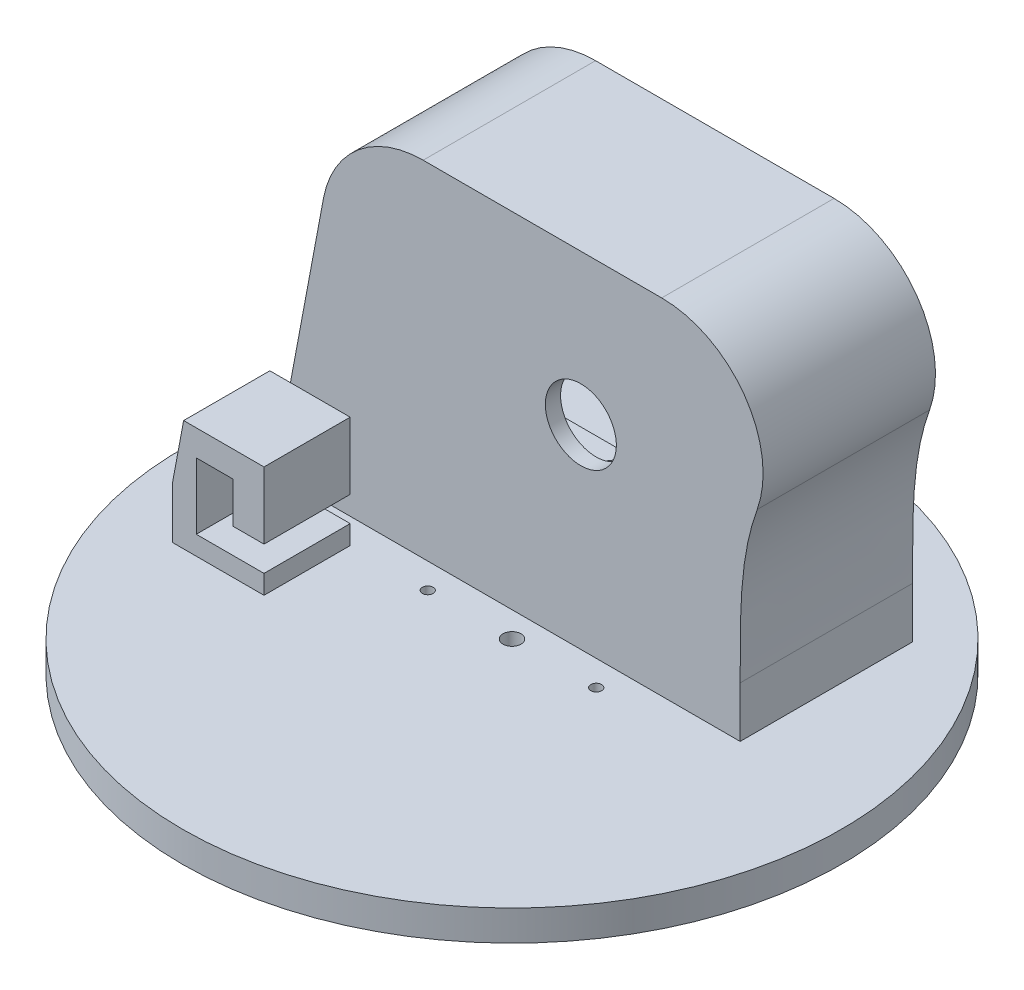
from build123d import *

# Parameters (mm, degrees)
SKETCH1_R           = 32.5
SKETCH1_R_2         = 0.889
SKETCH1_R_3         = 0.5335
BOSS_EXTRUDE1_DEPTH = 3
SKETCH2_W           = 45
SKETCH2_H           = 17
BOSS_EXTRUDE2_DEPTH = 5
LOFT1_START         = -19.5
LOFT1_DEPTH         = 17
FILLET2_R           = 10
CUT_EXTRUDE7_DEPTH  = 6.5
CUT_EXTRUDE8_DEPTH  = 9
SKETCH59_R          = 1.05
CUT_EXTRUDE9_DEPTH  = 6
SKETCH60_R          = 3.5
CUT_EXTRUDE10_DEPTH = 62.304245363
BOSS_EXTRUDE3_DEPTH = 11
CUT_EXTRUDE11_REACH = 53.415
SKETCH62_W          = 9.042987319
SKETCH62_H          = 2.5
SKETCH63_W          = 22
SKETCH63_H          = 5.75
CUT_EXTRUDE12_DEPTH = 10


# Read off the part's stored shape, not the designer's step: Loft1
with BuildPart() as part:
    # Sketch1 → Boss-Extrude1 (new body)
    with BuildSketch(Plane(origin=(0, 0, 0), x_dir=(1, 0, 0), z_dir=(0, 1, 0))):
        with Locations(Location((0, 0, 0), (0, 0, 270))):
            Circle(SKETCH1_R)
        with Locations(Location((0, 0, 0), (0, 0, 270))):
            Circle(SKETCH1_R_2, mode=Mode.SUBTRACT)
        with Locations(Location((-8.306, 0, 0), (0, 0, 270))):
            Circle(SKETCH1_R_3, mode=Mode.SUBTRACT)
        with Locations(Location((8.306, 0, 0), (0, 0, 90))):
            Circle(SKETCH1_R_3, mode=Mode.SUBTRACT)
    extrude(amount=BOSS_EXTRUDE1_DEPTH)

    # Sketch2 → Boss-Extrude2 (add)
    with BuildSketch(Plane(origin=(0, 3, 0), x_dir=(1, 0, 0), z_dir=(0, 1, 0))):
        with Locations((-2.5, 11)):
            Rectangle(SKETCH2_W, SKETCH2_H)
    extrude(amount=BOSS_EXTRUDE2_DEPTH)

    # Loft1 outline → Loft1 (add)
    with BuildSketch(Plane.XY.offset(LOFT1_START)):
        with BuildLine():
            Line((-25, 8), (20, 8))
            add(Edge.make_bspline(
                [(20, 8), (20.013119001, 12.366637273), (19.711715011, 23.342908392), (26.277458631, 32.792620463), (30.786821215, 37.0096)],
                knots=[0, 0, 0, 0, 0.412101617, 1, 1, 1, 1], degree=3))
            Line((30.786821215, 37.0096), (-19.558686419, 37.0096))
            Line((-19.558686419, 37.0096), (-25, 8))
        make_face()
    extrude(amount=LOFT1_DEPTH)

    # Fillet2
    fillet2_edges = [part.edges().sort_by_distance(p)[0] for p in [
        (30.786821215, 37.0096, -11),
        (-19.558686419, 37.0096, -11),
    ]]
    fillet(fillet2_edges, radius=FILLET2_R)

    # Sketch56 → Cut-Extrude7 (cut)
    with BuildSketch(Plane(origin=(0, 0, -19.5), x_dir=(-1, 0, 0), z_dir=(0, 0, -1))):
        with BuildLine():
            Line((11.259989716, 35.0096), (-12.262162003, 35.0096))
            ThreePointArc((-12.262162003, 35.0096), (-18.800326154, 31.619633572), (-19.797451062, 24.322702384))
            add(Edge.make_bspline(
                [(-19.797451062, 24.322702384), (-19.33456189, 23.024549565), (-18.970633179, 21.699807372), (-18.444923303, 18.9960086), (-18.278988003, 17.628977113), (-18.070720499, 14.883614823), (-18.028473243, 13.506968306), (-17.995025378, 10.755326884), (-18.004134147, 9.379048249), (-18, 8.003004365)],
                knots=[0, 0, 0, 0, 0.25, 0.25, 0.5, 0.5, 0.75, 0.75, 1, 1, 1, 1], degree=3))
            Line((-18, 8.003004365), (-18, 5))
            Line((-18, 5), (23, 5))
            Line((23, 5), (23, 7.814051971))
            Line((23, 7.814051971), (19.122868337, 28.484435511))
            ThreePointArc((19.122868337, 28.484435511), (16.368870019, 33.165844151), (11.259989716, 35.0096))
        make_face()
    extrude(amount=-CUT_EXTRUDE7_DEPTH, mode=Mode.SUBTRACT)

    # Sketch57 → Cut-Extrude8 (cut)
    with BuildSketch(Plane(origin=(0, 0, -13), x_dir=(-1, 0, 0), z_dir=(0, 0, -1))):
        Polygon((-6.147589592, 30.253616288), (-12.539757722, 19.62816634), (6.997359924, 7.874824939), (13.389528054, 18.500274887), align=None)
    extrude(amount=-CUT_EXTRUDE8_DEPTH, mode=Mode.SUBTRACT)

    # Sketch59 → Cut-Extrude9 (cut)
    with BuildSketch(Plane(origin=(0, 0, -13), x_dir=(-1, 0, 0), z_dir=(0, 0, -1))):
        with Locations((-11.850080197, 26.448721296)):
            Circle(SKETCH59_R)
        with Locations((12.699850529, 11.679719931)):
            Circle(SKETCH59_R)
    extrude(amount=-CUT_EXTRUDE9_DEPTH, mode=Mode.SUBTRACT)

    # Sketch60 → Cut-Extrude10 (cut, through all)
    with BuildSketch(Plane(origin=(0, 0, -4), x_dir=(-1, 0, 0), z_dir=(0, 0, -1))):
        with Locations((-4.287675332, 22.191003874)):
            Circle(SKETCH60_R)
    extrude(amount=-CUT_EXTRUDE10_DEPTH, mode=Mode.SUBTRACT)

    # Sketch61 → Boss-Extrude3 (add)
    with BuildSketch(Plane.XY.offset(-2.5)):
        Polygon((-25, 3), (-15.957012681, 3), (-15.957012681, 4.875346451), (-22.634257591, 4.875346451), (-22.634257591, 8.517700202), (-22.634257591, 11.401095106), (-19.020402646, 11.401095106), (-19.020402646, 7.370992949), (-15.957012681, 7.370992949), (-15.957012681, 13.965550524), (-23.881045203, 13.965550524), (-25, 8), align=None)
    extrude(amount=BOSS_EXTRUDE3_DEPTH)

    # Cut-Extrude11: up to this face of the body (flat: up to its plane)
    cut_extrude11_end = Plane(part.part.faces().sort_by_distance((1.612350985, 3, 3.31348115))[0])
    # Sketch62 → Cut-Extrude11 (cut, up to the picked face)
    with BuildSketch(Plane(origin=(0, 13.965550524, 0), x_dir=(1, 0, 0), z_dir=(0, 1, 0)), mode=Mode.PRIVATE) as cut_extrude11_sk1:
        with Locations((-20.478506341, 1.25)):
            Rectangle(SKETCH62_W, SKETCH62_H)
    cut_extrude11_tool1 = split(extrude(cut_extrude11_sk1.sketch, amount=-CUT_EXTRUDE11_REACH, mode=Mode.PRIVATE), bisect_by=cut_extrude11_end, keep=Keep.BOTH, mode=Mode.PRIVATE)
    add(cut_extrude11_tool1.solids().sort_by(Axis((-20.478506, 13.965551, -1.25), (0, -1, 0)))[0], mode=Mode.SUBTRACT)

    # Sketch63 → Cut-Extrude12 (cut)
    with BuildSketch(Plane(origin=(0, 3, 0), x_dir=(1, 0, 0), z_dir=(0, 1, 0))):
        with Locations((-0.259989716, 24.466538137)):
            Rectangle(SKETCH63_W, SKETCH63_H)
    extrude(amount=-CUT_EXTRUDE12_DEPTH, mode=Mode.SUBTRACT)


solid = part.part
